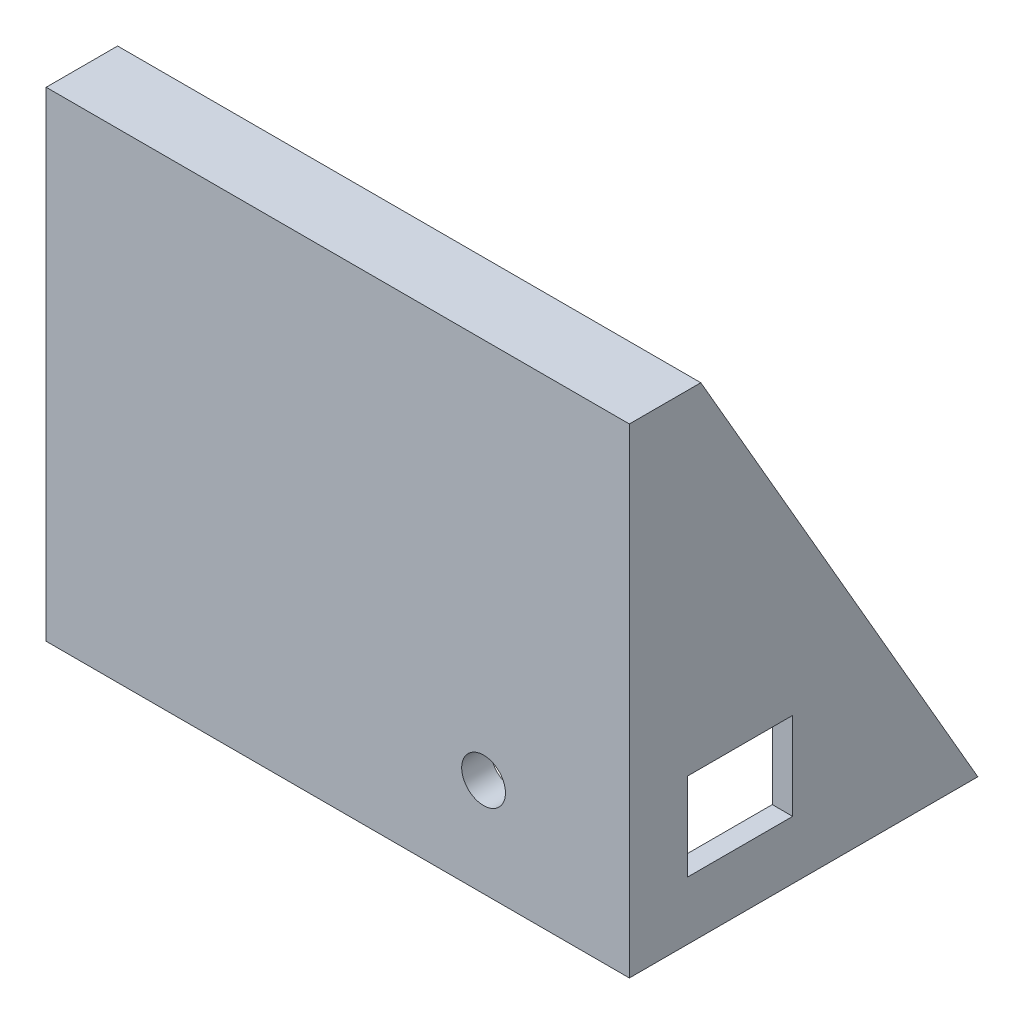
from build123d import *

# Parameters (mm, degrees)
BOSS_EXTRUDE1_DEPTH      = 200
SHELL1_T                 = -10
SHELL1_THICKNESS_2_DEPTH = 3
SHELL1_THICKNESS_3_DEPTH = 3
SKETCH4_R                = 2.5
CUT_EXTRUDE2_DEPTH       = 5
SKETCH5_W                = 36
SKETCH5_H                = 30
CUT_EXTRUDE3_DEPTH       = 20
SKETCH6_R                = 7.5
CUT_EXTRUDE4_DEPTH       = 20


with BuildPart() as part:
    # Sketch2 → Boss-Extrude1 (new body)
    with BuildSketch(Plane(origin=(0, 0, 0), x_dir=(0, 0, -1), z_dir=(1, 0, 0))):
        Polygon((0, 60.789473684), (24.5, 60.789473684), (119.5, -103.755353035), (0, -103.755353035), align=None)
    extrude(amount=BOSS_EXTRUDE1_DEPTH)

    # Shell1
    shell1_openings = [part.faces().sort_by_distance(p)[0] for p in [
        (100, -103.755353035, -59.75),
    ]]
    offset(amount=SHELL1_T, openings=shell1_openings, kind=Kind.INTERSECTION)

    # Shell1 thickness 2 face (on inner face of the shell) → Shell1 thickness 2 (cut)
    with BuildSketch(Plane(origin=(190, -48.02643305, -42.888943831), x_dir=(0, 0, 1), z_dir=(1, 0, 0))):
        Polygon((32.888943831, -98.815906734), (24.162446523, -98.815906734), (-65.064050785, 55.728919985), (32.888943831, 55.728919985), align=None)
    extrude(amount=SHELL1_THICKNESS_2_DEPTH, mode=Mode.SUBTRACT)

    # Shell1 thickness 3 face (on inner face of the shell) → Shell1 thickness 3 (cut)
    with BuildSketch(Plane(origin=(10, -48.02643305, -42.888943831), x_dir=(0, 0, -1), z_dir=(-1, 0, 0))):
        Polygon((-24.162446523, -98.815906734), (-32.888943831, -98.815906734), (-32.888943831, 55.728919985), (65.064050785, 55.728919985), align=None)
    extrude(amount=SHELL1_THICKNESS_3_DEPTH, mode=Mode.SUBTRACT)

    # Sketch4 → Cut-Extrude2 (cut)
    with BuildSketch(Plane(origin=(0, 25.806179617, -44.697614247), x_dir=(-1, 0, 0), z_dir=(0, 0.499999999999998, -0.8660254037844397))):
        with Locations((-185, 0.395228493)):
            Circle(SKETCH4_R)
        with Locations((-185, -109.604771507)):
            Circle(SKETCH4_R)
        with Locations((-155, -139.604771507)):
            Circle(SKETCH4_R)
        with Locations((-45, -139.604771507)):
            Circle(SKETCH4_R)
        with Locations((-15, -109.604771507)):
            Circle(SKETCH4_R)
        with Locations((-15, 0.395228493)):
            Circle(SKETCH4_R)
        with Locations((-45, 30.395228493)):
            Circle(SKETCH4_R)
        with Locations((-155, 30.395228493)):
            Circle(SKETCH4_R)
    extrude(amount=-CUT_EXTRUDE2_DEPTH, mode=Mode.SUBTRACT)

    # Sketch5 → Cut-Extrude3 (cut)
    with BuildSketch(Plane(origin=(200, 0, 0), x_dir=(0, 0, -1), z_dir=(1, 0, 0))):
        with Locations((38, -68.755353035)):
            Rectangle(SKETCH5_W, SKETCH5_H)
    extrude(amount=-CUT_EXTRUDE3_DEPTH, mode=Mode.SUBTRACT)

    # Sketch6 → Cut-Extrude4 (cut)
    with BuildSketch(Plane.XY):
        with Locations((150, -70.035876083)):
            Circle(SKETCH6_R)
    extrude(amount=-CUT_EXTRUDE4_DEPTH, mode=Mode.SUBTRACT)


solid = part.part
